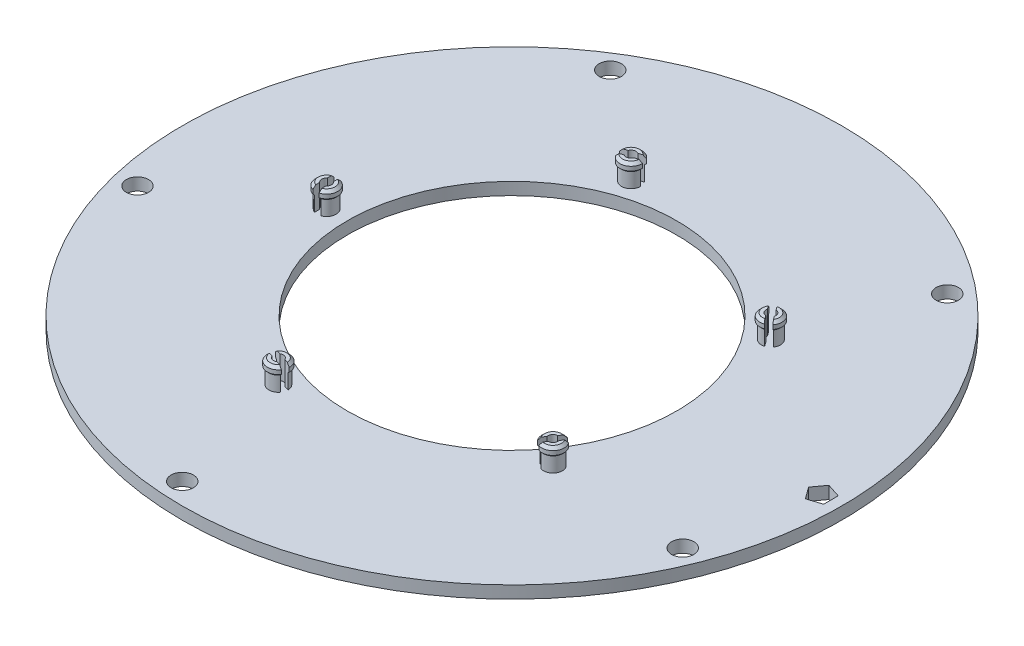
from build123d import *
from OCP.BRepAlgoAPI import BRepAlgoAPI_Cut
from OCP.TopTools import TopTools_ListOfShape

# Parameters (mm, degrees)
SKETCH1_R           = 80
SKETCH1_R_2         = 40
BOSS_EXTRUDE1_DEPTH = 3
SKETCH2_R           = 2.7
CUT_EXTRUDE5_DEPTH  = 114.176853
CIRPATTERN3_COUNT   = 5
SKETCH3_R           = 2.3
BOSS_EXTRUDE3_DEPTH = 4
SKETCH4_R           = 2.7
BOSS_EXTRUDE4_DEPTH = 1
CHAMFER1_SIZE       = 0.4
SKETCH5_R           = 2.05
BOSS_EXTRUDE5_DEPTH = 0.65
CHAMFER2_SIZE       = 0.65
CUT_EXTRUDE1_REACH  = 115.467
SKETCH7_R           = 1.2
CUT_EXTRUDE2_DEPTH  = 5.65
CIRPATTERN2_START   = -1
CIRPATTERN2_DEPTH   = 6.65
CIRPATTERN2_START_2 = 3.599992
CIRPATTERN2_2_DEPTH = 2.050008
CUT_EXTRUDE3_DEPTH  = 114.278076


with BuildPart() as part:
    # Sketch1 → Boss-Extrude1 (new body)
    with BuildSketch(Plane(origin=(0, 0, 0), x_dir=(1, 0, 0), z_dir=(0, 1, 0))):
        with Locations(Location((0, 0, 0), (0, 0, 270))):
            Circle(SKETCH1_R)
        with Locations(Location((0, 0, 0), (0, 0, 270))):
            Circle(SKETCH1_R_2, mode=Mode.SUBTRACT)
    extrude(amount=-BOSS_EXTRUDE1_DEPTH)

    # Sketch2 → Cut-Extrude5 (cut, through all)
    with BuildSketch(Plane(origin=(0, 0, 0), x_dir=(1, 0, 0), z_dir=(0, 1, 0))):
        with Locations(Location((48.209071, 57.453333, 0), (0, 0, 270))):
            Circle(SKETCH2_R)
    cut_extrude5 = extrude(amount=-CUT_EXTRUDE5_DEPTH, mode=Mode.SUBTRACT)

    # CirPattern3: Cut-Extrude5 ×5 about axis
    cirpattern3_axis = Axis((0, 0, 0), (0, 1, 0))
    for i in range(1, CIRPATTERN3_COUNT):
        add(cut_extrude5.rotate(cirpattern3_axis, i * 360 / CIRPATTERN3_COUNT), mode=Mode.SUBTRACT)

    # Sketch3 → Boss-Extrude3 (add)
    with BuildSketch(Plane(origin=(0, 0, 0), x_dir=(1, 0, 0), z_dir=(0, 1, 0))):
        with Locations(Location((-45, 0, 0), (0, 0, 270))):
            Circle(SKETCH3_R)
    extrude(amount=BOSS_EXTRUDE3_DEPTH)

    # Sketch4 → Boss-Extrude4 (add)
    with BuildSketch(Plane(origin=(0, 4, 0), x_dir=(1, 0, 0), z_dir=(0, 1, 0))):
        with Locations(Location((-45, 0, 0), (0, 0, 270))):
            Circle(SKETCH4_R)
    extrude(amount=BOSS_EXTRUDE4_DEPTH)

    # Chamfer1
    chamfer1_edges = [part.edges().sort_by_distance(p)[0] for p in [
        (-45, 4, -2.3),
    ]]
    chamfer(chamfer1_edges, length=CHAMFER1_SIZE - 0.0001)  # a hair under: the kernel refuses the full size

    # Sketch5 → Boss-Extrude5 (add)
    with BuildSketch(Plane(origin=(0, 5, 0), x_dir=(1, 0, 0), z_dir=(0, 1, 0))):
        with Locations(Location((-45, 0, 0), (0, 0, 270))):
            Circle(SKETCH5_R)
    extrude(amount=BOSS_EXTRUDE5_DEPTH)

    # Chamfer2
    chamfer2_edges = [part.edges().sort_by_distance(p)[0] for p in [
        (-45, 5, -2.05),
    ]]
    chamfer(chamfer2_edges, length=CHAMFER2_SIZE - 0.0001)  # a hair under: the kernel refuses the full size

    # Cut-Extrude1: up to this face of the body (flat: up to its plane)
    cut_extrude1_end = Plane(part.part.faces().sort_by_distance((0, 0, -77.737258))[0])
    # Sketch6 → Cut-Extrude1 (cut, up to the picked face)
    with BuildSketch(Plane(origin=(0, 5.65, 0), x_dir=(1, 0, 0), z_dir=(0, 1, 0)), mode=Mode.PRIVATE) as cut_extrude1_sk1:
        with BuildLine():
            Line((-44.25, 1.907878), (-44.25, 4.94343))
            ThreePointArc((-44.25, 4.94343), (-45, 5), (-45.75, 4.94343))
            Line((-45.75, 4.94343), (-45.75, 1.907878))
            ThreePointArc((-45.75, 1.907878), (-45, 2.05), (-44.25, 1.907878))
        make_face()
    cut_extrude1_tool1 = split(extrude(cut_extrude1_sk1.sketch, amount=-CUT_EXTRUDE1_REACH, mode=Mode.PRIVATE), bisect_by=cut_extrude1_end, keep=Keep.BOTH, mode=Mode.PRIVATE)
    # Sketch6 → Cut-Extrude1 (cut, up to the picked face)
    with BuildSketch(Plane(origin=(0, 5.65, 0), x_dir=(1, 0, 0), z_dir=(0, 1, 0)), mode=Mode.PRIVATE) as cut_extrude1_sk2:
        with BuildLine():
            Line((-44.25, -4.94343), (-44.25, -1.907878))
            ThreePointArc((-44.25, -1.907878), (-45, -2.05), (-45.75, -1.907878))
            Line((-45.75, -1.907878), (-45.75, -4.94343))
            ThreePointArc((-45.75, -4.94343), (-45, -5), (-44.25, -4.94343))
        make_face()
    cut_extrude1_tool2 = split(extrude(cut_extrude1_sk2.sketch, amount=-CUT_EXTRUDE1_REACH, mode=Mode.PRIVATE), bisect_by=cut_extrude1_end, keep=Keep.BOTH, mode=Mode.PRIVATE)
    # Sketch6 → Cut-Extrude1 (cut, up to the picked face)
    with BuildSketch(Plane(origin=(0, 5.65, 0), x_dir=(1, 0, 0), z_dir=(0, 1, 0)), mode=Mode.PRIVATE) as cut_extrude1_sk3:
        with BuildLine():
            Line((-44.25, -1.907878), (-44.25, 1.907878))
            ThreePointArc((-44.25, 1.907878), (-45, 2.05), (-45.75, 1.907878))
            Line((-45.75, 1.907878), (-45.75, -1.907878))
            ThreePointArc((-45.75, -1.907878), (-45, -2.05), (-44.25, -1.907878))
        make_face()
    cut_extrude1_tool3 = split(extrude(cut_extrude1_sk3.sketch, amount=-CUT_EXTRUDE1_REACH, mode=Mode.PRIVATE), bisect_by=cut_extrude1_end, keep=Keep.BOTH, mode=Mode.PRIVATE)
    # Sketch6 → Cut-Extrude1 (cut, up to the picked face)
    with BuildSketch(Plane(origin=(0, 5.65, 0), x_dir=(1, 0, 0), z_dir=(0, 1, 0)), mode=Mode.PRIVATE) as cut_extrude1_sk4:
        with BuildLine():
            Line((-44.25, 1.907878), (-44.25, 4.94343))
            ThreePointArc((-44.25, 4.94343), (-45, 5), (-45.75, 4.94343))
            Line((-45.75, 4.94343), (-45.75, 1.907878))
            ThreePointArc((-45.75, 1.907878), (-45, 2.05), (-44.25, 1.907878))
        make_face()
    cut_extrude1_tool4 = split(extrude(cut_extrude1_sk4.sketch, amount=-CUT_EXTRUDE1_REACH, mode=Mode.PRIVATE), bisect_by=cut_extrude1_end, keep=Keep.BOTH, mode=Mode.PRIVATE)
    # Sketch6 → Cut-Extrude1 (cut, up to the picked face)
    with BuildSketch(Plane(origin=(0, 5.65, 0), x_dir=(1, 0, 0), z_dir=(0, 1, 0)), mode=Mode.PRIVATE) as cut_extrude1_sk5:
        with BuildLine():
            Line((-44.25, -4.94343), (-44.25, -1.907878))
            ThreePointArc((-44.25, -1.907878), (-45, -2.05), (-45.75, -1.907878))
            Line((-45.75, -1.907878), (-45.75, -4.94343))
            ThreePointArc((-45.75, -4.94343), (-45, -5), (-44.25, -4.94343))
        make_face()
    cut_extrude1_tool5 = split(extrude(cut_extrude1_sk5.sketch, amount=-CUT_EXTRUDE1_REACH, mode=Mode.PRIVATE), bisect_by=cut_extrude1_end, keep=Keep.BOTH, mode=Mode.PRIVATE)
    add(cut_extrude1_tool1.solids().sort_by(Axis((-45, 5.65, -3.491994), (0, -1, 0)))[0], mode=Mode.SUBTRACT)
    add(cut_extrude1_tool2.solids().sort_by(Axis((-45, 5.65, 3.491994), (0, -1, 0)))[0], mode=Mode.SUBTRACT)
    add(cut_extrude1_tool3.solids().sort_by(Axis((-45, 5.65, 0), (0, -1, 0)))[0], mode=Mode.SUBTRACT)
    add(cut_extrude1_tool4.solids().sort_by(Axis((-45, 5.65, -3.491994), (0, -1, 0)))[0], mode=Mode.SUBTRACT)
    add(cut_extrude1_tool5.solids().sort_by(Axis((-45, 5.65, 3.491994), (0, -1, 0)))[0], mode=Mode.SUBTRACT)

    # Sketch7 → Cut-Extrude2 (cut)
    with BuildSketch(Plane(origin=(0, 5.65, 0), x_dir=(1, 0, 0), z_dir=(0, 1, 0))):
        with Locations((-45, 0)):
            Circle(SKETCH7_R)
    extrude(amount=-CUT_EXTRUDE2_DEPTH, mode=Mode.SUBTRACT)


with BuildPart() as cirpattern2_tool:
    # CirPattern2: read off the stored shape, not the designer's step
    # CirPattern2 outline → CirPattern2 (new body)
    with BuildSketch(Plane(origin=(0, 0, 0), x_dir=(1, 0, 0), z_dir=(0, 1, 0)).offset(CIRPATTERN2_START)):
        with BuildLine():
            ThreePointArc((-12.7831, 42.373722), (-13.534944, 41.656275), (-14.564904, 41.794779))
            Line((-14.564904, 41.794779), (-15.741867, 41.412361))
            ThreePointArc((-15.741867, 41.412361), (-13.195026, 40.610113), (-11.606137, 42.756141))
            Line((-11.606137, 42.756141), (-12.7831, 42.373722))
        make_face()
        with BuildLine():
            Line((-16.205392, 42.838946), (-15.028429, 43.221364))
            ThreePointArc((-15.028429, 43.221364), (-14.276585, 43.938811), (-13.246626, 43.800307))
            Line((-13.246626, 43.800307), (-12.069663, 44.182726))
            ThreePointArc((-12.069663, 44.182726), (-14.616504, 44.984973), (-16.205392, 42.838946))
        make_face()
        with BuildLine():
            ThreePointArc((36.34961, 25.251651), (35.434944, 25.744994), (35.248394, 26.767344))
            Line((35.248394, 26.767344), (34.520991, 27.768528))
            ThreePointArc((34.520991, 27.768528), (34.545026, 25.09843), (37.077013, 24.250467))
            Line((37.077013, 24.250467), (36.34961, 25.251651))
        make_face()
        with BuildLine():
            Line((35.734517, 28.650206), (36.46192, 27.649022))
            ThreePointArc((36.46192, 27.649022), (37.376585, 27.155679), (37.563135, 26.133329))
            Line((37.563135, 26.133329), (38.290538, 25.132145))
            ThreePointArc((38.290538, 25.132145), (38.266504, 27.802242), (35.734517, 28.650206))
        make_face()
        with BuildLine():
            ThreePointArc((35.248394, -26.767344), (35.434944, -25.744994), (36.34961, -25.251651))
            Line((36.34961, -25.251651), (37.077013, -24.250467))
            ThreePointArc((37.077013, -24.250467), (34.545026, -25.09843), (34.520991, -27.768528))
            Line((34.520991, -27.768528), (35.248394, -26.767344))
        make_face()
        with BuildLine():
            Line((38.290538, -25.132145), (37.563135, -26.133329))
            ThreePointArc((37.563135, -26.133329), (37.376585, -27.155679), (36.46192, -27.649022))
            Line((36.46192, -27.649022), (35.734517, -28.650206))
            ThreePointArc((35.734517, -28.650206), (38.266504, -27.802242), (38.290538, -25.132145))
        make_face()
        with BuildLine():
            ThreePointArc((-14.564904, -41.794779), (-13.534944, -41.656275), (-12.7831, -42.373722))
            Line((-12.7831, -42.373722), (-11.606137, -42.756141))
            ThreePointArc((-11.606137, -42.756141), (-13.195026, -40.610113), (-15.741867, -41.412361))
            Line((-15.741867, -41.412361), (-14.564904, -41.794779))
        make_face()
        with BuildLine():
            Line((-12.069663, -44.182726), (-13.246626, -43.800307))
            ThreePointArc((-13.246626, -43.800307), (-14.276585, -43.938811), (-15.028429, -43.221364))
            Line((-15.028429, -43.221364), (-16.205392, -42.838946))
            ThreePointArc((-16.205392, -42.838946), (-14.616504, -44.984973), (-12.069663, -44.182726))
        make_face()
    extrude(amount=CIRPATTERN2_DEPTH)


with BuildPart() as part_1:
    add(part.part)


with BuildPart() as part_2:
    # CirPattern2: joined with cirpattern2_tool
    add(part_1.part.fuse(cirpattern2_tool.part, tol=0.00001))


with BuildPart() as cirpattern2_2_tool:
    # CirPattern2 2 outline → CirPattern2 2 (new body)
    with BuildSketch(Plane(origin=(0, 0, 0), x_dir=(1, 0, 0), z_dir=(0, 1, 0)).offset(CIRPATTERN2_START_2)):
        with BuildLine():
            ThreePointArc((-11.606137, 42.756141), (-13.195026, 40.610113), (-15.741867, 41.412361))
            Line((-15.741867, 41.412361), (-16.140798, 41.28274))
            ThreePointArc((-16.140798, 41.28274), (-13.071419, 40.229691), (-11.207206, 42.885761))
            Line((-11.207206, 42.885761), (-11.606137, 42.756141))
        make_face()
        with BuildLine():
            Line((-16.604323, 42.709325), (-16.205392, 42.838946))
            ThreePointArc((-16.205392, 42.838946), (-14.616504, 44.984973), (-12.069663, 44.182726))
            Line((-12.069663, 44.182726), (-11.670732, 44.312346))
            ThreePointArc((-11.670732, 44.312346), (-14.740111, 45.365396), (-16.604323, 42.709325))
        make_face()
        with BuildLine():
            ThreePointArc((37.077013, 24.250467), (34.545026, 25.09843), (34.520991, 27.768528))
            Line((34.520991, 27.768528), (34.274438, 28.107879))
            ThreePointArc((34.274438, 28.107879), (34.221419, 24.863316), (37.323566, 23.911116))
            Line((37.323566, 23.911116), (37.077013, 24.250467))
        make_face()
        with BuildLine():
            Line((35.487964, 28.989557), (35.734517, 28.650206))
            ThreePointArc((35.734517, 28.650206), (38.266504, 27.802242), (38.290538, 25.132145))
            Line((38.290538, 25.132145), (38.537091, 24.792794))
            ThreePointArc((38.537091, 24.792794), (38.590111, 28.037357), (35.487964, 28.989557))
        make_face()
        with BuildLine():
            ThreePointArc((34.520991, -27.768528), (34.545026, -25.09843), (37.077013, -24.250467))
            Line((37.077013, -24.250467), (37.323566, -23.911116))
            ThreePointArc((37.323566, -23.911116), (34.221419, -24.863316), (34.274438, -28.107879))
            Line((34.274438, -28.107879), (34.520991, -27.768528))
        make_face()
        with BuildLine():
            Line((38.537091, -24.792794), (38.290538, -25.132145))
            ThreePointArc((38.290538, -25.132145), (38.266504, -27.802242), (35.734517, -28.650206))
            Line((35.734517, -28.650206), (35.487964, -28.989557))
            ThreePointArc((35.487964, -28.989557), (38.590111, -28.037357), (38.537091, -24.792794))
        make_face()
        with BuildLine():
            ThreePointArc((-15.741867, -41.412361), (-13.195026, -40.610113), (-11.606137, -42.756141))
            Line((-11.606137, -42.756141), (-11.207206, -42.885761))
            ThreePointArc((-11.207206, -42.885761), (-13.071419, -40.229691), (-16.140798, -41.28274))
            Line((-16.140798, -41.28274), (-15.741867, -41.412361))
        make_face()
        with BuildLine():
            Line((-11.670732, -44.312346), (-12.069663, -44.182726))
            ThreePointArc((-12.069663, -44.182726), (-14.616504, -44.984973), (-16.205392, -42.838946))
            Line((-16.205392, -42.838946), (-16.604323, -42.709325))
            ThreePointArc((-16.604323, -42.709325), (-14.740111, -45.365396), (-11.670732, -44.312346))
        make_face()
    extrude(amount=CIRPATTERN2_2_DEPTH)


with BuildPart() as part_3:
    add(part_2.part)


with BuildPart() as part_4:
    # CirPattern2 2: joined with cirpattern2_2_tool
    add(part_3.part.fuse(cirpattern2_2_tool.part, tol=0.00001))


with BuildPart() as cirpattern2_3_tool:
    # CirPattern2 3 outline → CirPattern2 3 (revolve)
    with BuildSketch(Plane(origin=(-13.905765, 0, 42.797543), x_dir=(1, 0, 0), z_dir=(0, 0, 1))):
        Polygon((2.7, 4), (2.3, 3.6), (2.7, 3.599992), align=None)
        Polygon((2.05, 5.65), (2.7, 5), (2.7, 5.65), align=None)
    revolve(axis=Axis((-13.905765, 0, 42.797543), (0, 1, 0)))


with BuildPart() as part_5:
    add(part_4.part)

    # CirPattern2 3: cut by cirpattern2_3_tool, with a tolerance
    cirpattern2_3_stock = TopTools_ListOfShape()
    cirpattern2_3_stock.Append(part_5.part.wrapped)
    cirpattern2_3_tools = TopTools_ListOfShape()
    cirpattern2_3_tools.Append(cirpattern2_3_tool.part.wrapped)
    cirpattern2_3_cut = BRepAlgoAPI_Cut()
    cirpattern2_3_cut.SetArguments(cirpattern2_3_stock)
    cirpattern2_3_cut.SetTools(cirpattern2_3_tools)
    cirpattern2_3_cut.SetFuzzyValue(0.00001)
    cirpattern2_3_cut.Build()
    add(Compound.cast(cirpattern2_3_cut.Shape()).solids(), mode=Mode.REPLACE)


with BuildPart() as cirpattern2_4_tool:
    # CirPattern2 4 outline → CirPattern2 4 (revolve)
    with BuildSketch(Plane(origin=(36.405765, 0, 26.450336), x_dir=(1, 0, 0), z_dir=(0, 0, 1))):
        Polygon((2.7, 4), (2.3, 3.6), (2.7, 3.599992), align=None)
        Polygon((2.05, 5.65), (2.7, 5), (2.7, 5.65), align=None)
    revolve(axis=Axis((36.405765, 0, 26.450336), (0, 1, 0)))


with BuildPart() as part_6:
    add(part_5.part)

    # CirPattern2 4: cut by cirpattern2_4_tool, with a tolerance
    cirpattern2_4_stock = TopTools_ListOfShape()
    cirpattern2_4_stock.Append(part_6.part.wrapped)
    cirpattern2_4_tools = TopTools_ListOfShape()
    cirpattern2_4_tools.Append(cirpattern2_4_tool.part.wrapped)
    cirpattern2_4_cut = BRepAlgoAPI_Cut()
    cirpattern2_4_cut.SetArguments(cirpattern2_4_stock)
    cirpattern2_4_cut.SetTools(cirpattern2_4_tools)
    cirpattern2_4_cut.SetFuzzyValue(0.00001)
    cirpattern2_4_cut.Build()
    add(Compound.cast(cirpattern2_4_cut.Shape()).solids(), mode=Mode.REPLACE)


with BuildPart() as cirpattern2_5_tool:
    # CirPattern2 5 outline → CirPattern2 5 (revolve)
    with BuildSketch(Plane(origin=(36.405765, 0, -26.450336), x_dir=(1, 0, 0), z_dir=(0, 0, 1))):
        Polygon((2.7, 4), (2.3, 3.6), (2.7, 3.599992), align=None)
        Polygon((2.05, 5.65), (2.7, 5), (2.7, 5.65), align=None)
    revolve(axis=Axis((36.405765, 0, -26.450336), (0, 1, 0)))


with BuildPart() as part_7:
    add(part_6.part)

    # CirPattern2 5: cut by cirpattern2_5_tool, with a tolerance
    cirpattern2_5_stock = TopTools_ListOfShape()
    cirpattern2_5_stock.Append(part_7.part.wrapped)
    cirpattern2_5_tools = TopTools_ListOfShape()
    cirpattern2_5_tools.Append(cirpattern2_5_tool.part.wrapped)
    cirpattern2_5_cut = BRepAlgoAPI_Cut()
    cirpattern2_5_cut.SetArguments(cirpattern2_5_stock)
    cirpattern2_5_cut.SetTools(cirpattern2_5_tools)
    cirpattern2_5_cut.SetFuzzyValue(0.00001)
    cirpattern2_5_cut.Build()
    add(Compound.cast(cirpattern2_5_cut.Shape()).solids(), mode=Mode.REPLACE)


with BuildPart() as cirpattern2_6_tool:
    # CirPattern2 6 outline → CirPattern2 6 (revolve)
    with BuildSketch(Plane(origin=(-13.905765, 0, -42.797543), x_dir=(1, 0, 0), z_dir=(0, 0, 1))):
        Polygon((2.7, 4), (2.3, 3.6), (2.7, 3.599992), align=None)
        Polygon((2.05, 5.65), (2.7, 5), (2.7, 5.65), align=None)
    revolve(axis=Axis((-13.905765, 0, -42.797543), (0, 1, 0)))


with BuildPart() as part_8:
    add(part_7.part)

    # CirPattern2 6: cut by cirpattern2_6_tool, with a tolerance
    cirpattern2_6_stock = TopTools_ListOfShape()
    cirpattern2_6_stock.Append(part_8.part.wrapped)
    cirpattern2_6_tools = TopTools_ListOfShape()
    cirpattern2_6_tools.Append(cirpattern2_6_tool.part.wrapped)
    cirpattern2_6_cut = BRepAlgoAPI_Cut()
    cirpattern2_6_cut.SetArguments(cirpattern2_6_stock)
    cirpattern2_6_cut.SetTools(cirpattern2_6_tools)
    cirpattern2_6_cut.SetFuzzyValue(0.00001)
    cirpattern2_6_cut.Build()
    add(Compound.cast(cirpattern2_6_cut.Shape()).solids(), mode=Mode.REPLACE)

    # Sketch8 → Cut-Extrude3 (cut, through all)
    with BuildSketch(Plane(origin=(0, 0, 0), x_dir=(1, 0, 0), z_dir=(0, 1, 0))):
        Polygon((72, 0), (74.072949, -2.85317), (77.427051, -1.763356), (77.427051, 1.763356), (74.072949, 2.85317), align=None)
    extrude(amount=-CUT_EXTRUDE3_DEPTH, mode=Mode.SUBTRACT)


solid = part_8.part
